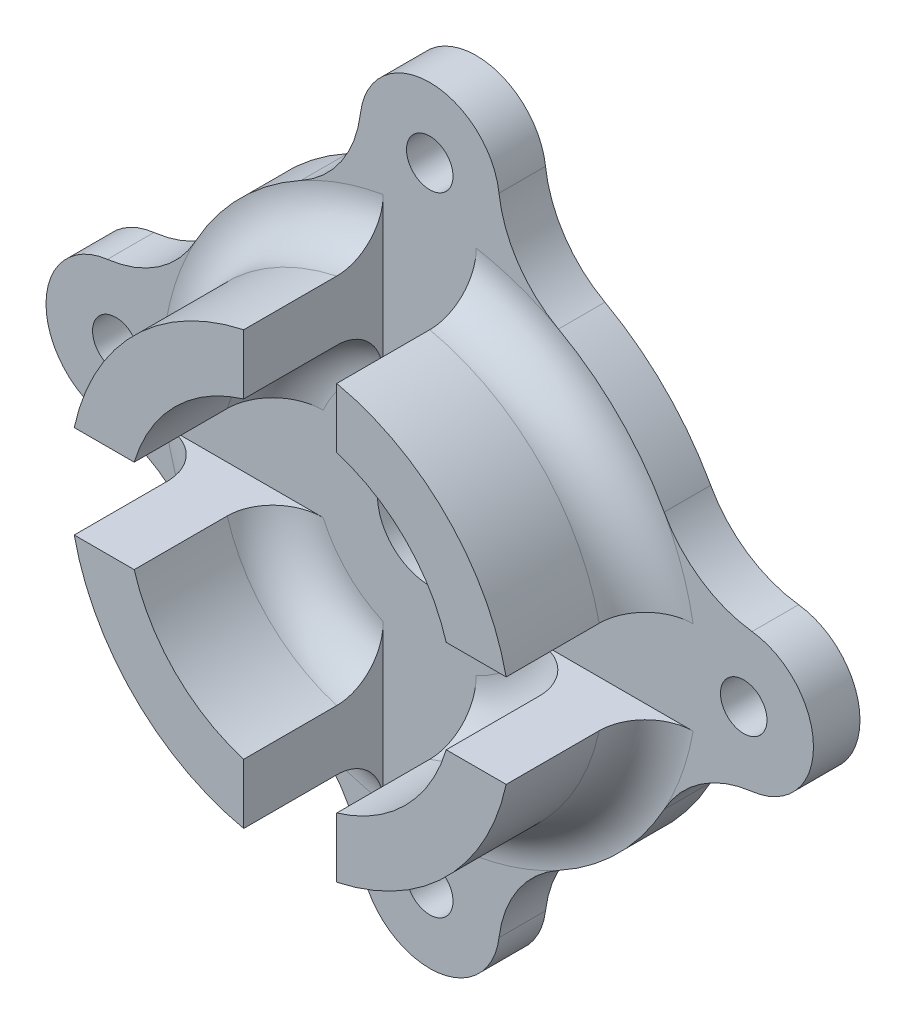
from build123d import *

# Parameters (mm, degrees)
SKETCH2_R           = 1.000000000000002
SKETCH2_R_2         = 1.0000000000000033
SKETCH2_R_3         = 2.2500000000000036
SKETCH2_R_4         = 0.9999999999999979
BOSS_EXTRUDE1_DEPTH = 2
BOSS_EXTRUDE2_DEPTH = 6
FILLET1_R           = 2


with BuildPart() as part:
    # Sketch2 → Boss-Extrude1 (new body)
    with BuildSketch(Plane.XY):
        with BuildLine():
            ThreePointArc((-5.535216541496454, -10.080246913580245), (-3.800103213400962, -11.661877619065859), (-2.9781871609138566, -13.86111111111111))
            ThreePointArc((-2.978187160913855, -13.86111111111111), (-1.22e-15, -16.500000000000007), (2.9781871609138544, -13.861111111111112))
            ThreePointArc((2.978187160913855, -13.861111111111114), (3.800103213400959, -11.661877619065862), (5.535216541496451, -10.080246913580247))
            ThreePointArc((5.5352165414964505, -10.080246913580245), (8.131727983645298, -8.131727983645296), (10.080246913580247, -5.535216541496448))
            ThreePointArc((10.080246913580249, -5.535216541496447), (11.661877619065859, -3.800103213400953), (13.861111111111109, -2.978187160913847))
            ThreePointArc((13.861111111111109, -2.9781871609138464), (16.5, 1.11e-15), (13.86111111111111, 2.97818716091385))
            ThreePointArc((13.861111111111109, 2.9781871609138504), (11.661877619065862, 3.8001032134009582), (10.080246913580249, 5.53521654149645))
            ThreePointArc((10.080246913580245, 5.53521654149645), (8.131727983645296, 8.131727983645295), (5.535216541496451, 10.080246913580247))
            ThreePointArc((5.535216541496451, 10.080246913580247), (3.8001032134009582, 11.66187761906586), (2.978187160913855, 13.861111111111112))
            ThreePointArc((2.978187160913854, 13.861111111111112), (-1.1e-16, 16.500000000000007), (-2.978187160913854, 13.861111111111112))
            ThreePointArc((-2.978187160913855, 13.86111111111111), (-3.8001032134009582, 11.661877619065859), (-5.535216541496451, 10.080246913580247))
            ThreePointArc((-5.53521654149645, 10.080246913580245), (-8.131727983645293, 8.131727983645298), (-10.080246913580247, 5.535216541496451))
            ThreePointArc((-10.080246913580247, 5.53521654149645), (-11.66187761906586, 3.800103213400954), (-13.861111111111112, 2.978187160913847))
            ThreePointArc((-13.861111111111112, 2.978187160913847), (-16.5, -4.22e-15), (-13.86111111111111, -2.978187160913854))
            ThreePointArc((-13.86111111111111, -2.978187160913853), (-11.661877619065862, -3.8001032134009574), (-10.080246913580249, -5.535216541496448))
            ThreePointArc((-10.080246913580247, -5.535216541496449), (-8.131727983645298, -8.131727983645291), (-5.535216541496458, -10.080246913580243))
        make_face()
        with Locations((0, -13.500000000000002)):
            Circle(SKETCH2_R, mode=Mode.SUBTRACT)
        with Locations((-13.5, -3.47e-15)):
            Circle(SKETCH2_R_2, mode=Mode.SUBTRACT)
        Circle(SKETCH2_R_3, mode=Mode.SUBTRACT)
        with Locations((13.499999999999998, 1.95e-15)):
            Circle(SKETCH2_R_4, mode=Mode.SUBTRACT)
        with Locations((0, 13.500000000000002)):
            Circle(SKETCH2_R, mode=Mode.SUBTRACT)
    extrude(amount=BOSS_EXTRUDE1_DEPTH)

    # Sketch3 → Boss-Extrude2 (add)
    with BuildSketch(Plane.XY.offset(2)):
        with BuildLine():
            Line((-2, 6.708203932499395), (-2, 9.287087810503353))
            ThreePointArc((-2.0000000000000093, 9.287087810503355), (-6.717514421272232, 6.717514421272174), (-9.28708781050337, 1.9999999999999327))
            Line((-9.287087810503404, 2.0000000000000977), (-6.708203932499403, 2.0000000000000706))
            ThreePointArc((-6.708203932499378, 1.99999999999997), (-4.949747468305826, 4.94974746830584), (-1.9999999999999525, 6.708203932499384))
        make_face()
        with BuildLine():
            Line((6.708203932499369, 1.9999999999999767), (9.287087810503435, 1.9999999999999678))
            ThreePointArc((9.287087810503401, 1.999999999999796), (6.7175144212723605, 6.717514421272045), (2.0000000000002314, 9.287087810503307))
            Line((2, 9.28708781050326), (2, 6.708203932499432))
            ThreePointArc((1.9999999999998863, 6.708203932499403), (4.949747468305795, 4.949747468305869), (6.708203932499373, 1.9999999999999882))
        make_face()
        with BuildLine():
            ThreePointArc((2.0000000000001776, -9.287087810503317), (6.717514421272327, -6.717514421272079), (9.28708781050339, -1.9999999999998435))
            Line((9.287087810503428, -2.000000000000032), (6.708203932499365, -2.000000000000023))
            ThreePointArc((6.708203932499362, -2.0000000000000218), (4.94974746830577, -4.949747468305895), (1.999999999999852, -6.708203932499413))
            Line((1.9999999999999531, -6.708203932499438), (1.9999999999999352, -9.287087810503271))
        make_face()
        with BuildLine():
            ThreePointArc((-9.287087810503401, -1.9999999999997904), (-6.717514421272299, -6.7175144212721065), (-2.0000000000000573, -9.287087810503344))
            Line((-2.0000000000000653, -9.287087810503346), (-2.000000000000047, -6.708203932499385))
            ThreePointArc((-1.9999999999999913, -6.708203932499372), (-4.94974746830588, -4.949747468305786), (-6.70820393249941, -1.9999999999998643))
            Line((-6.708203932499425, -1.9999999999999296), (-9.287087810503424, -1.9999999999999025))
        make_face()
    extrude(amount=BOSS_EXTRUDE2_DEPTH)

    # Fillet1
    # the kernel refuses this fillet: 2 mm, written as the material it adds along each edge
    with BuildSketch(Plane(origin=(2.22e-15, -8.9e-16, 2), x_dir=(-0.30916520847427376, -0.9510083458461649, 0), z_dir=(-0.9510083458461649, 0.30916520847427376, 0))) as fillet1_piece_1_section:
        with BuildLine():
            CenterArc((9.499999999999982 + FILLET1_R, FILLET1_R), FILLET1_R, 180, 90)
            Line((9.499999999999982, FILLET1_R), (9.499999999999982, 0))
            Line((9.499999999999982, 0), (9.499999999999982 + FILLET1_R, 0))
        make_face()
    fillet1_piece_1 = revolve(axis=Axis((2.22e-15, -8.9e-16, 2), (0, 0, 1)), revolution_arc=126.01785857571643, mode=Mode.PRIVATE)
    fillet1_piece_1 = split(fillet1_piece_1, bisect_by=Plane(origin=(-2.000000000000068, -9.669758969346212, 2.4215494769043446), z_dir=(-1, 7.06e-15, 0)), keep=Keep.TOP, mode=Mode.PRIVATE)
    add(fillet1_piece_1)
    with BuildSketch(Plane(origin=(2.22e-15, -8.9e-16, 2), x_dir=(-0.30916520847427376, -0.9510083458461649, 0), z_dir=(-0.9510083458461649, 0.30916520847427376, 0))) as fillet1_piece_2_section:
        with BuildLine():
            CenterArc((9.499999999999982 + FILLET1_R, FILLET1_R), FILLET1_R, 180, 90)
            Line((9.499999999999982, FILLET1_R), (9.499999999999982, 0))
            Line((9.499999999999982, 0), (9.499999999999982 + FILLET1_R, 0))
        make_face()
    fillet1_piece_2 = revolve(axis=Axis((2.22e-15, -8.9e-16, 2), (0, 0, 1)), revolution_arc=126.01785857571643, mode=Mode.PRIVATE)
    fillet1_piece_2 = split(fillet1_piece_2, bisect_by=Plane(origin=(7.120332445105562, -2.0000000000000244, 2.5696707124735063), z_dir=(-3.44e-15, -1, 0)), keep=Keep.TOP, mode=Mode.PRIVATE)
    fillet1_piece_2 = split(fillet1_piece_2, bisect_by=Plane(origin=(1.9999999999999503, -7.120332445105584, 2.5696707124735063), z_dir=(1, -6.97e-15, 0)), keep=Keep.TOP, mode=Mode.PRIVATE)
    add(fillet1_piece_2)
    with BuildSketch(Plane(origin=(2.22e-15, -8.9e-16, 2), x_dir=(-0.30916520847427376, -0.9510083458461649, 0), z_dir=(-0.9510083458461649, 0.30916520847427376, 0))) as fillet1_piece_3_section:
        with BuildLine():
            CenterArc((9.499999999999982 + FILLET1_R, FILLET1_R), FILLET1_R, 180, 90)
            Line((9.499999999999982, FILLET1_R), (9.499999999999982, 0))
            Line((9.499999999999982, 0), (9.499999999999982 + FILLET1_R, 0))
        make_face()
    fillet1_piece_3 = revolve(axis=Axis((2.22e-15, -8.9e-16, 2), (0, 0, 1)), revolution_arc=126.01785857571643, mode=Mode.PRIVATE)
    fillet1_piece_3 = split(fillet1_piece_3, bisect_by=Plane(origin=(9.669758933153426, 1.9999999999999665, 2.4215494191812885), z_dir=(3.44e-15, 1, 0)), keep=Keep.TOP, mode=Mode.PRIVATE)
    add(fillet1_piece_3)
    with BuildSketch(Plane(origin=(-3.55e-15, 2.89e-15, 2), x_dir=(0.9111837032687716, 0.4120003141957629, 0), z_dir=(-0.4120003141957629, 0.9111837032687716, 0))) as fillet1_piece_4_section:
        with BuildLine():
            CenterArc((7.000000000006363 - FILLET1_R, -FILLET1_R), FILLET1_R, 0, 90)
            Line((7.000000000006364, -FILLET1_R), (7.000000000006363, 0))
            Line((7.000000000006363, 0), (7.000000000006363 - FILLET1_R, 0))
        make_face()
    fillet1_piece_4 = revolve(axis=Axis((-3.55e-15, 2.89e-15, 2), (0, 0, -1)), revolution_arc=138.6611069957662, mode=Mode.PRIVATE)
    fillet1_piece_4 = split(fillet1_piece_4, bisect_by=Plane(origin=(6.213522354625176, 1.9999999999999785, 2.5168822123416867), z_dir=(3.44e-15, 1, 0)), keep=Keep.TOP, mode=Mode.PRIVATE)
    add(fillet1_piece_4)
    with BuildSketch(Plane(origin=(-3.55e-15, 2.89e-15, 2), x_dir=(0.9111837032687716, 0.4120003141957629, 0), z_dir=(-0.4120003141957629, 0.9111837032687716, 0))) as fillet1_piece_5_section:
        with BuildLine():
            CenterArc((7.000000000006363 - FILLET1_R, -FILLET1_R), FILLET1_R, 0, 90)
            Line((7.000000000006364, -FILLET1_R), (7.000000000006363, 0))
            Line((7.000000000006363, 0), (7.000000000006363 - FILLET1_R, 0))
        make_face()
    fillet1_piece_5 = revolve(axis=Axis((-3.55e-15, 2.89e-15, 2), (0, 0, -1)), revolution_arc=138.6611069957662, mode=Mode.PRIVATE)
    fillet1_piece_5 = split(fillet1_piece_5, bisect_by=Plane(origin=(4.488001494655117, -2.0000000000000155, 2.480936836750208), z_dir=(-3.44e-15, -1, 0)), keep=Keep.TOP, mode=Mode.PRIVATE)
    fillet1_piece_5 = split(fillet1_piece_5, bisect_by=Plane(origin=(1.9999999999999687, -4.488001186110315, 2.480936836750208), z_dir=(1, -6.97e-15, 0)), keep=Keep.TOP, mode=Mode.PRIVATE)
    add(fillet1_piece_5)
    with BuildSketch(Plane(origin=(-3.55e-15, 2.89e-15, 2), x_dir=(0.9111837032687716, 0.4120003141957629, 0), z_dir=(-0.4120003141957629, 0.9111837032687716, 0))) as fillet1_piece_6_section:
        with BuildLine():
            CenterArc((7.000000000006363 - FILLET1_R, -FILLET1_R), FILLET1_R, 0, 90)
            Line((7.000000000006364, -FILLET1_R), (7.000000000006363, 0))
            Line((7.000000000006363, 0), (7.000000000006363 - FILLET1_R, 0))
        make_face()
    fillet1_piece_6 = revolve(axis=Axis((-3.55e-15, 2.89e-15, 2), (0, 0, -1)), revolution_arc=138.6611069957662, mode=Mode.PRIVATE)
    fillet1_piece_6 = split(fillet1_piece_6, bisect_by=Plane(origin=(-2.0000000000000435, -6.213522307784187, 2.516882137154894), z_dir=(-1, 7.06e-15, 0)), keep=Keep.TOP, mode=Mode.PRIVATE)
    add(fillet1_piece_6)
    with BuildSketch(Plane(origin=(-4.88e-15, -5.33e-15, 2), x_dir=(-0.9510083458461519, 0.30916520847431384, 0), z_dir=(0.30916520847431384, 0.9510083458461519, 0))) as fillet1_piece_7_section:
        with BuildLine():
            CenterArc((9.499999999999979 + FILLET1_R, FILLET1_R), FILLET1_R, 180, 90)
            Line((9.49999999999998, FILLET1_R), (9.499999999999979, 0))
            Line((9.499999999999979, 0), (9.499999999999979 + FILLET1_R, 0))
        make_face()
    fillet1_piece_7 = revolve(axis=Axis((-4.88e-15, -5.33e-15, 2), (0, 0, 1)), revolution_arc=126.01785857571757, mode=Mode.PRIVATE)
    fillet1_piece_7 = split(fillet1_piece_7, bisect_by=Plane(origin=(-9.669758969346136, 2.0000000000001017, 2.421549476904353), z_dir=(1.05e-14, 1, 0)), keep=Keep.TOP, mode=Mode.PRIVATE)
    add(fillet1_piece_7)
    with BuildSketch(Plane(origin=(-4.88e-15, -5.33e-15, 2), x_dir=(-0.9510083458461519, 0.30916520847431384, 0), z_dir=(0.30916520847431384, 0.9510083458461519, 0))) as fillet1_piece_8_section:
        with BuildLine():
            CenterArc((9.499999999999979 + FILLET1_R, FILLET1_R), FILLET1_R, 180, 90)
            Line((9.49999999999998, FILLET1_R), (9.499999999999979, 0))
            Line((9.499999999999979, 0), (9.499999999999979 + FILLET1_R, 0))
        make_face()
    fillet1_piece_8 = revolve(axis=Axis((-4.88e-15, -5.33e-15, 2), (0, 0, 1)), revolution_arc=126.01785857571757, mode=Mode.PRIVATE)
    fillet1_piece_8 = split(fillet1_piece_8, bisect_by=Plane(origin=(-2.00000000000005, -7.120332445105555, 2.5696707124735054), z_dir=(-1, 7.06e-15, 0)), keep=Keep.TOP, mode=Mode.PRIVATE)
    fillet1_piece_8 = split(fillet1_piece_8, bisect_by=Plane(origin=(-7.12033244510559, -1.9999999999999254, 2.5696707124735054), z_dir=(-1.05e-14, -1, 0)), keep=Keep.TOP, mode=Mode.PRIVATE)
    add(fillet1_piece_8)
    with BuildSketch(Plane(origin=(-4.88e-15, -5.33e-15, 2), x_dir=(-0.9510083458461519, 0.30916520847431384, 0), z_dir=(0.30916520847431384, 0.9510083458461519, 0))) as fillet1_piece_9_section:
        with BuildLine():
            CenterArc((9.499999999999979 + FILLET1_R, FILLET1_R), FILLET1_R, 180, 90)
            Line((9.49999999999998, FILLET1_R), (9.499999999999979, 0))
            Line((9.499999999999979, 0), (9.499999999999979 + FILLET1_R, 0))
        make_face()
    fillet1_piece_9 = revolve(axis=Axis((-4.88e-15, -5.33e-15, 2), (0, 0, 1)), revolution_arc=126.01785857571757, mode=Mode.PRIVATE)
    fillet1_piece_9 = split(fillet1_piece_9, bisect_by=Plane(origin=(1.9999999999999325, -9.66975893315346, 2.421549419181287), z_dir=(1, -6.97e-15, 0)), keep=Keep.TOP, mode=Mode.PRIVATE)
    add(fillet1_piece_9)
    with BuildSketch(Plane(origin=(6.22e-15, 6.88e-15, 2), x_dir=(0.41200031419576666, -0.9111837032687699, 0), z_dir=(0.9111837032687699, 0.41200031419576666, 0))) as fillet1_piece_10_section:
        with BuildLine():
            CenterArc((7.000000000006322 - FILLET1_R, -FILLET1_R), FILLET1_R, 0, 90)
            Line((7.000000000006323, -FILLET1_R), (7.000000000006322, 0))
            Line((7.000000000006322, 0), (7.000000000006322 - FILLET1_R, 0))
        make_face()
    fillet1_piece_10 = revolve(axis=Axis((6.22e-15, 6.88e-15, 2), (0, 0, -1)), revolution_arc=138.6611069957663, mode=Mode.PRIVATE)
    fillet1_piece_10 = split(fillet1_piece_10, bisect_by=Plane(origin=(1.9999999999999567, -6.213522354625126, 2.5168822123416836), z_dir=(1, -6.97e-15, 0)), keep=Keep.TOP, mode=Mode.PRIVATE)
    add(fillet1_piece_10)
    with BuildSketch(Plane(origin=(6.22e-15, 6.88e-15, 2), x_dir=(0.41200031419576666, -0.9111837032687699, 0), z_dir=(0.9111837032687699, 0.41200031419576666, 0))) as fillet1_piece_11_section:
        with BuildLine():
            CenterArc((7.000000000006322 - FILLET1_R, -FILLET1_R), FILLET1_R, 0, 90)
            Line((7.000000000006323, -FILLET1_R), (7.000000000006322, 0))
            Line((7.000000000006322, 0), (7.000000000006322 - FILLET1_R, 0))
        make_face()
    fillet1_piece_11 = revolve(axis=Axis((6.22e-15, 6.88e-15, 2), (0, 0, -1)), revolution_arc=138.6611069957663, mode=Mode.PRIVATE)
    fillet1_piece_11 = split(fillet1_piece_11, bisect_by=Plane(origin=(-2.0000000000000315, -4.48800149465508, 2.480936836750209), z_dir=(-1, 7.06e-15, 0)), keep=Keep.TOP, mode=Mode.PRIVATE)
    fillet1_piece_11 = split(fillet1_piece_11, bisect_by=Plane(origin=(-4.488001186110293, -1.999999999999953, 2.480936836750209), z_dir=(-1.05e-14, -1, 0)), keep=Keep.TOP, mode=Mode.PRIVATE)
    add(fillet1_piece_11)
    with BuildSketch(Plane(origin=(6.22e-15, 6.88e-15, 2), x_dir=(0.41200031419576666, -0.9111837032687699, 0), z_dir=(0.9111837032687699, 0.41200031419576666, 0))) as fillet1_piece_12_section:
        with BuildLine():
            CenterArc((7.000000000006322 - FILLET1_R, -FILLET1_R), FILLET1_R, 0, 90)
            Line((7.000000000006323, -FILLET1_R), (7.000000000006322, 0))
            Line((7.000000000006322, 0), (7.000000000006322 - FILLET1_R, 0))
        make_face()
    fillet1_piece_12 = revolve(axis=Axis((6.22e-15, 6.88e-15, 2), (0, 0, -1)), revolution_arc=138.6611069957663, mode=Mode.PRIVATE)
    fillet1_piece_12 = split(fillet1_piece_12, bisect_by=Plane(origin=(-6.21352230778415, 2.0000000000000653, 2.5168821371548966), z_dir=(1.05e-14, 1, 0)), keep=Keep.TOP, mode=Mode.PRIVATE)
    add(fillet1_piece_12)
    with BuildSketch(Plane(origin=(-1.33e-15, 2.22e-15, 2), x_dir=(0.3091652084742909, 0.9510083458461592, 0), z_dir=(0.9510083458461592, -0.3091652084742909, 0))) as fillet1_piece_13_section:
        with BuildLine():
            CenterArc((9.499999999999982 + FILLET1_R, FILLET1_R), FILLET1_R, 180, 90)
            Line((9.499999999999984, FILLET1_R), (9.499999999999982, 0))
            Line((9.499999999999982, 0), (9.499999999999982 + FILLET1_R, 0))
        make_face()
    fillet1_piece_13 = revolve(axis=Axis((-1.33e-15, 2.22e-15, 2), (0, 0, 1)), revolution_arc=126.01785857571691, mode=Mode.PRIVATE)
    fillet1_piece_13 = split(fillet1_piece_13, bisect_by=Plane(origin=(2, 9.66975896934618, 2.4215494769043477), z_dir=(1, 0, 0)), keep=Keep.TOP, mode=Mode.PRIVATE)
    add(fillet1_piece_13)
    with BuildSketch(Plane(origin=(-1.33e-15, 2.22e-15, 2), x_dir=(0.3091652084742909, 0.9510083458461592, 0), z_dir=(0.9510083458461592, -0.3091652084742909, 0))) as fillet1_piece_14_section:
        with BuildLine():
            CenterArc((9.499999999999982 + FILLET1_R, FILLET1_R), FILLET1_R, 180, 90)
            Line((9.499999999999984, FILLET1_R), (9.499999999999982, 0))
            Line((9.499999999999982, 0), (9.499999999999982 + FILLET1_R, 0))
        make_face()
    fillet1_piece_14 = revolve(axis=Axis((-1.33e-15, 2.22e-15, 2), (0, 0, 1)), revolution_arc=126.01785857571691, mode=Mode.PRIVATE)
    fillet1_piece_14 = split(fillet1_piece_14, bisect_by=Plane(origin=(-7.120332445105595, 2.000000000000075, 2.569670712473507), z_dir=(1.05e-14, 1, 0)), keep=Keep.TOP, mode=Mode.PRIVATE)
    fillet1_piece_14 = split(fillet1_piece_14, bisect_by=Plane(origin=(-2, 7.120332445105617, 2.569670712473507), z_dir=(-1, 0, 0)), keep=Keep.TOP, mode=Mode.PRIVATE)
    add(fillet1_piece_14)
    with BuildSketch(Plane(origin=(-1.33e-15, 2.22e-15, 2), x_dir=(0.3091652084742909, 0.9510083458461592, 0), z_dir=(0.9510083458461592, -0.3091652084742909, 0))) as fillet1_piece_15_section:
        with BuildLine():
            CenterArc((9.499999999999982 + FILLET1_R, FILLET1_R), FILLET1_R, 180, 90)
            Line((9.499999999999984, FILLET1_R), (9.499999999999982, 0))
            Line((9.499999999999982, 0), (9.499999999999982 + FILLET1_R, 0))
        make_face()
    fillet1_piece_15 = revolve(axis=Axis((-1.33e-15, 2.22e-15, 2), (0, 0, 1)), revolution_arc=126.01785857571691, mode=Mode.PRIVATE)
    fillet1_piece_15 = split(fillet1_piece_15, bisect_by=Plane(origin=(-9.669758933153439, -1.9999999999998985, 2.4215494191812867), z_dir=(-1.05e-14, -1, 0)), keep=Keep.TOP, mode=Mode.PRIVATE)
    add(fillet1_piece_15)
    with BuildSketch(Plane(origin=(5.33e-15, -4.88e-15, 2), x_dir=(-0.9111837032687685, -0.4120003141957696, 0), z_dir=(0.4120003141957696, -0.9111837032687685, 0))) as fillet1_piece_16_section:
        with BuildLine():
            CenterArc((7.000000000006354 - FILLET1_R, -FILLET1_R), FILLET1_R, 0, 90)
            Line((7.000000000006354, -FILLET1_R), (7.000000000006354, 0))
            Line((7.000000000006354, 0), (7.000000000006354 - FILLET1_R, 0))
        make_face()
    fillet1_piece_16 = revolve(axis=Axis((5.33e-15, -4.88e-15, 2), (0, 0, -1)), revolution_arc=138.66110699576575, mode=Mode.PRIVATE)
    fillet1_piece_16 = split(fillet1_piece_16, bisect_by=Plane(origin=(-6.213522354625151, -1.9999999999999347, 2.5168822123416796), z_dir=(-1.05e-14, -1, 0)), keep=Keep.TOP, mode=Mode.PRIVATE)
    add(fillet1_piece_16)
    with BuildSketch(Plane(origin=(5.33e-15, -4.88e-15, 2), x_dir=(-0.9111837032687685, -0.4120003141957696, 0), z_dir=(0.4120003141957696, -0.9111837032687685, 0))) as fillet1_piece_17_section:
        with BuildLine():
            CenterArc((7.000000000006354 - FILLET1_R, -FILLET1_R), FILLET1_R, 0, 90)
            Line((7.000000000006354, -FILLET1_R), (7.000000000006354, 0))
            Line((7.000000000006354, 0), (7.000000000006354 - FILLET1_R, 0))
        make_face()
    fillet1_piece_17 = revolve(axis=Axis((5.33e-15, -4.88e-15, 2), (0, 0, -1)), revolution_arc=138.66110699576575, mode=Mode.PRIVATE)
    fillet1_piece_17 = split(fillet1_piece_17, bisect_by=Plane(origin=(-4.488001494655129, 2.000000000000047, 2.4809368367502085), z_dir=(1.05e-14, 1, 0)), keep=Keep.TOP, mode=Mode.PRIVATE)
    fillet1_piece_17 = split(fillet1_piece_17, bisect_by=Plane(origin=(-2, 4.488001186110333, 2.4809368367502085), z_dir=(-1, 0, 0)), keep=Keep.TOP, mode=Mode.PRIVATE)
    add(fillet1_piece_17)
    with BuildSketch(Plane(origin=(5.33e-15, -4.88e-15, 2), x_dir=(-0.9111837032687685, -0.4120003141957696, 0), z_dir=(0.4120003141957696, -0.9111837032687685, 0))) as fillet1_piece_18_section:
        with BuildLine():
            CenterArc((7.000000000006354 - FILLET1_R, -FILLET1_R), FILLET1_R, 0, 90)
            Line((7.000000000006354, -FILLET1_R), (7.000000000006354, 0))
            Line((7.000000000006354, 0), (7.000000000006354 - FILLET1_R, 0))
        make_face()
    fillet1_piece_18 = revolve(axis=Axis((5.33e-15, -4.88e-15, 2), (0, 0, -1)), revolution_arc=138.66110699576575, mode=Mode.PRIVATE)
    fillet1_piece_18 = split(fillet1_piece_18, bisect_by=Plane(origin=(2, 6.213522307784205, 2.5168821371548975), z_dir=(1, 0, 0)), keep=Keep.TOP, mode=Mode.PRIVATE)
    add(fillet1_piece_18)
    with BuildSketch(Plane(origin=(-1.33e-15, -2.22e-15, 2), x_dir=(0.9510083458461523, -0.30916520847431234, 0), z_dir=(-0.30916520847431234, -0.9510083458461523, 0))) as fillet1_piece_19_section:
        with BuildLine():
            CenterArc((9.49999999999999 + FILLET1_R, FILLET1_R), FILLET1_R, 180, 90)
            Line((9.49999999999999, FILLET1_R), (9.49999999999999, 0))
            Line((9.49999999999999, 0), (9.49999999999999 + FILLET1_R, 0))
        make_face()
    fillet1_piece_19 = revolve(axis=Axis((-1.33e-15, -2.22e-15, 2), (0, 0, 1)), revolution_arc=126.01785857571633, mode=Mode.PRIVATE)
    fillet1_piece_19 = split(fillet1_piece_19, bisect_by=Plane(origin=(9.669758969346143, -2.0000000000000333, 2.421549476904354), z_dir=(-3.44e-15, -1, 0)), keep=Keep.TOP, mode=Mode.PRIVATE)
    add(fillet1_piece_19)
    with BuildSketch(Plane(origin=(-1.33e-15, -2.22e-15, 2), x_dir=(0.9510083458461523, -0.30916520847431234, 0), z_dir=(-0.30916520847431234, -0.9510083458461523, 0))) as fillet1_piece_20_section:
        with BuildLine():
            CenterArc((9.49999999999999 + FILLET1_R, FILLET1_R), FILLET1_R, 180, 90)
            Line((9.49999999999999, FILLET1_R), (9.49999999999999, 0))
            Line((9.49999999999999, 0), (9.49999999999999 + FILLET1_R, 0))
        make_face()
    fillet1_piece_20 = revolve(axis=Axis((-1.33e-15, -2.22e-15, 2), (0, 0, 1)), revolution_arc=126.01785857571633, mode=Mode.PRIVATE)
    fillet1_piece_20 = split(fillet1_piece_20, bisect_by=Plane(origin=(2, 7.120332445105565, 2.5696707124735063), z_dir=(1, 0, 0)), keep=Keep.TOP, mode=Mode.PRIVATE)
    fillet1_piece_20 = split(fillet1_piece_20, bisect_by=Plane(origin=(7.120332445105574, 1.9999999999999754, 2.5696707124735063), z_dir=(3.44e-15, 1, 0)), keep=Keep.TOP, mode=Mode.PRIVATE)
    add(fillet1_piece_20)
    with BuildSketch(Plane(origin=(-1.33e-15, -2.22e-15, 2), x_dir=(0.9510083458461523, -0.30916520847431234, 0), z_dir=(-0.30916520847431234, -0.9510083458461523, 0))) as fillet1_piece_21_section:
        with BuildLine():
            CenterArc((9.49999999999999 + FILLET1_R, FILLET1_R), FILLET1_R, 180, 90)
            Line((9.49999999999999, FILLET1_R), (9.49999999999999, 0))
            Line((9.49999999999999, 0), (9.49999999999999 + FILLET1_R, 0))
        make_face()
    fillet1_piece_21 = revolve(axis=Axis((-1.33e-15, -2.22e-15, 2), (0, 0, 1)), revolution_arc=126.01785857571633, mode=Mode.PRIVATE)
    fillet1_piece_21 = split(fillet1_piece_21, bisect_by=Plane(origin=(-2, 9.669758933153492, 2.4215494191812805), z_dir=(-1, 0, 0)), keep=Keep.TOP, mode=Mode.PRIVATE)
    add(fillet1_piece_21)
    with BuildSketch(Plane(origin=(-7.55e-15, -7.77e-15, 2), x_dir=(-0.41200031419578037, 0.9111837032687635, 0), z_dir=(-0.9111837032687635, -0.41200031419578037, 0))) as fillet1_piece_22_section:
        with BuildLine():
            CenterArc((7.0000000000063665 - FILLET1_R, -FILLET1_R), FILLET1_R, 0, 90)
            Line((7.0000000000063665, -FILLET1_R), (7.0000000000063665, 0))
            Line((7.0000000000063665, 0), (7.0000000000063665 - FILLET1_R, 0))
        make_face()
    fillet1_piece_22 = revolve(axis=Axis((-7.55e-15, -7.77e-15, 2), (0, 0, -1)), revolution_arc=138.66110699576606, mode=Mode.PRIVATE)
    fillet1_piece_22 = split(fillet1_piece_22, bisect_by=Plane(origin=(-2, 6.213522354625137, 2.5168822123416787), z_dir=(-1, 0, 0)), keep=Keep.TOP, mode=Mode.PRIVATE)
    add(fillet1_piece_22)
    with BuildSketch(Plane(origin=(-7.55e-15, -7.77e-15, 2), x_dir=(-0.41200031419578037, 0.9111837032687635, 0), z_dir=(-0.9111837032687635, -0.41200031419578037, 0))) as fillet1_piece_23_section:
        with BuildLine():
            CenterArc((7.0000000000063665 - FILLET1_R, -FILLET1_R), FILLET1_R, 0, 90)
            Line((7.0000000000063665, -FILLET1_R), (7.0000000000063665, 0))
            Line((7.0000000000063665, 0), (7.0000000000063665 - FILLET1_R, 0))
        make_face()
    fillet1_piece_23 = revolve(axis=Axis((-7.55e-15, -7.77e-15, 2), (0, 0, -1)), revolution_arc=138.66110699576606, mode=Mode.PRIVATE)
    fillet1_piece_23 = split(fillet1_piece_23, bisect_by=Plane(origin=(2, 4.488001494655124, 2.4809368367502085), z_dir=(1, 0, 0)), keep=Keep.TOP, mode=Mode.PRIVATE)
    fillet1_piece_23 = split(fillet1_piece_23, bisect_by=Plane(origin=(4.488001186110306, 1.9999999999999842, 2.4809368367502085), z_dir=(3.44e-15, 1, 0)), keep=Keep.TOP, mode=Mode.PRIVATE)
    add(fillet1_piece_23)
    with BuildSketch(Plane(origin=(-7.55e-15, -7.77e-15, 2), x_dir=(-0.41200031419578037, 0.9111837032687635, 0), z_dir=(-0.9111837032687635, -0.41200031419578037, 0))) as fillet1_piece_24_section:
        with BuildLine():
            CenterArc((7.0000000000063665 - FILLET1_R, -FILLET1_R), FILLET1_R, 0, 90)
            Line((7.0000000000063665, -FILLET1_R), (7.0000000000063665, 0))
            Line((7.0000000000063665, 0), (7.0000000000063665 - FILLET1_R, 0))
        make_face()
    fillet1_piece_24 = revolve(axis=Axis((-7.55e-15, -7.77e-15, 2), (0, 0, -1)), revolution_arc=138.66110699576606, mode=Mode.PRIVATE)
    fillet1_piece_24 = split(fillet1_piece_24, bisect_by=Plane(origin=(6.213522307784227, -2.0000000000000213, 2.5168821371548997), z_dir=(-3.44e-15, -1, 0)), keep=Keep.TOP, mode=Mode.PRIVATE)
    add(fillet1_piece_24)


solid = part.part
